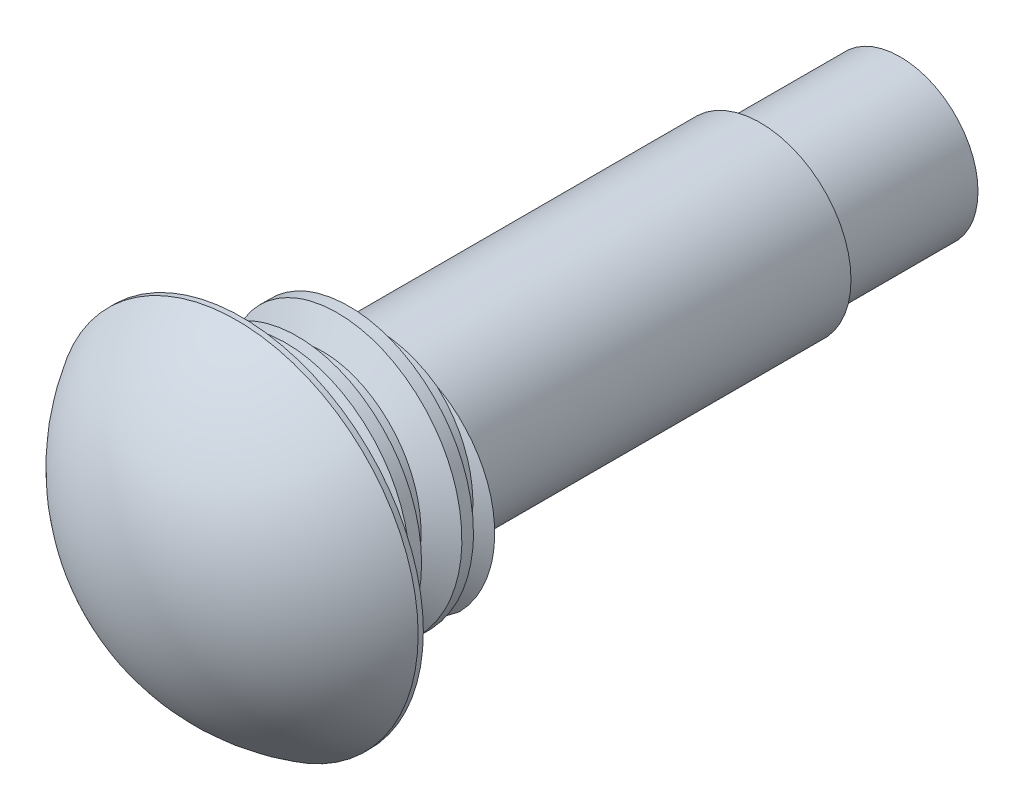
from build123d import *

# Parameters (mm, degrees)
SKETCH3_R           = 3.175
BOSS_EXTRUDE1_DEPTH = 3.302
CUT_SWEEP1_PITCH    = 1.27
SKETCH8_R           = 2.2225
BOSS_EXTRUDE3_DEPTH = 9.398
SKETCH10_R          = 1.905
BOSS_EXTRUDE5_DEPTH = 3.429
SKETCH11_R          = 4.445
BOSS_EXTRUDE6_DEPTH = 0.127
DOME1_FACE_RADIUS   = 4.445
DOME1_HEIGHT        = 2.54


with BuildPart() as part:
    # Sketch3 → Boss-Extrude1 (new body)
    with BuildSketch(Plane.XY):
        with Locations(Location((0, 0, 0), (0, 0, 180))):
            Circle(SKETCH3_R)
    extrude(amount=BOSS_EXTRUDE1_DEPTH)

    # Cut-Sweep1: arcs per turn and ends read off the stored shape
    # Cut-Sweep1: the profile of Sketch5 profile screwed along a left-hand helix through 4.5 turns, 8 arcs to a turn; built about Z, then put on its axis
    cut_sweep1_z = Axis((0, 0, 0), (0, 0, 1))
    cut_sweep1_corners = [(2.54, 0, -1.397), (3.1753, 0, -1.763790626), (3.1753, 0, -0.776209374), (2.54, 0, -1.143)]
    with BuildLine(mode=Mode.PRIVATE) as cut_sweep1_profile:
        Line(cut_sweep1_corners[0], cut_sweep1_corners[1])
        Line(cut_sweep1_corners[1], cut_sweep1_corners[2])
        Line(cut_sweep1_corners[2], cut_sweep1_corners[3])
        Line(cut_sweep1_corners[3], cut_sweep1_corners[0])
    cut_sweep1_cap = Face(cut_sweep1_profile.wire())
    cut_sweep1_turn_angles = [0, -22.5, -45, -67.5, -90, -112.5, -135, -157.5, -180, -202.5, -225, -247.5, -270, -292.5, -315, -337.5, -360]
    cut_sweep1_turn_weights = [1, 0.9238795325112867, 1, 0.9238795325112867, 1, 0.9238795325112867, 1, 0.9238795325112867, 1, 0.9238795325112867, 1, 0.9238795325112867, 1, 0.9238795325112867, 1, 0.9238795325112867, 1]
    cut_sweep1_turn_rails = [Edge.make_bspline([Vector(p[0], p[1], 0).rotate(cut_sweep1_z, cut_sweep1_turn_angles[k]) / cut_sweep1_turn_weights[k] + Vector(0, 0, p[2] + -CUT_SWEEP1_PITCH * cut_sweep1_turn_angles[k] / 360) for k in range(17)], [0, 0, 0, 1, 1, 2, 2, 3, 3, 4, 4, 5, 5, 6, 6, 7, 7, 8, 8, 8], 2, cut_sweep1_turn_weights) for p in cut_sweep1_corners]
    cut_sweep1_turn_sides = [Face.make_surface_from_curves(cut_sweep1_turn_rails[p[0]], cut_sweep1_turn_rails[p[1]]) for p in [(0, 1), (1, 2), (2, 3), (3, 0)]]
    cut_sweep1_last_angles = [-1440, -1462.5, -1485, -1507.5, -1530, -1552.5, -1575, -1597.5, -1620]
    cut_sweep1_last_weights = [1, 0.9238795325112867, 1, 0.9238795325112867, 1, 0.9238795325112867, 1, 0.9238795325112867, 1]
    cut_sweep1_last_rails = [Edge.make_bspline([Vector(p[0], p[1], 0).rotate(cut_sweep1_z, cut_sweep1_last_angles[k]) / cut_sweep1_last_weights[k] + Vector(0, 0, p[2] + -CUT_SWEEP1_PITCH * cut_sweep1_last_angles[k] / 360) for k in range(9)], [0, 0, 0, 1, 1, 2, 2, 3, 3, 4, 4, 4], 2, cut_sweep1_last_weights) for p in cut_sweep1_corners]
    cut_sweep1_last_sides = [Face.make_surface_from_curves(cut_sweep1_last_rails[p[0]], cut_sweep1_last_rails[p[1]]) for p in [(0, 1), (1, 2), (2, 3), (3, 0)]]
    cut_sweep1 = Plane(origin=(0, 0, 0), x_dir=(0, 1, 0), z_dir=(0, 0, 1)) * Solid(Shell([*[p.moved(Location((0, 0, CUT_SWEEP1_PITCH * i))) for i in range(4) for p in cut_sweep1_turn_sides], *cut_sweep1_last_sides, cut_sweep1_cap, cut_sweep1_cap.rotate(cut_sweep1_z, -1620).moved(Location((0, 0, -CUT_SWEEP1_PITCH * -1620 / 360)))]))
    add(cut_sweep1, mode=Mode.SUBTRACT)

    # Sketch8 → Boss-Extrude3 (add)
    with BuildSketch(Plane.XY):
        Circle(SKETCH8_R)
    extrude(amount=-BOSS_EXTRUDE3_DEPTH)

    # Sketch10 → Boss-Extrude5 (add)
    with BuildSketch(Plane(origin=(0, 0, -9.398), x_dir=(-1, 0, 0), z_dir=(0, 0, -1))):
        with Locations(Location((0, 0, 0), (0, 0, 180))):
            Circle(SKETCH10_R)
    extrude(amount=BOSS_EXTRUDE5_DEPTH)

    # Sketch11 → Boss-Extrude6 (add)
    with BuildSketch(Plane.XY.offset(3.302)):
        Circle(SKETCH11_R)
    extrude(amount=BOSS_EXTRUDE6_DEPTH)

    # Dome1: a dome of height H over a round flat face of radius A is a cap of a sphere of radius (A * A + H * H) / (2 * H)
    dome1_r = (DOME1_FACE_RADIUS * DOME1_FACE_RADIUS + DOME1_HEIGHT * DOME1_HEIGHT) / (2 * DOME1_HEIGHT)
    dome1_base = Plane((0, 0, 3.429), z_dir=(0, 0, 1))
    with Locations(dome1_base.offset(DOME1_HEIGHT - dome1_r)):
        dome1_ball = Sphere(dome1_r, mode=Mode.PRIVATE)
    add(split(dome1_ball, bisect_by=dome1_base, keep=Keep.TOP, mode=Mode.PRIVATE))


solid = part.part
